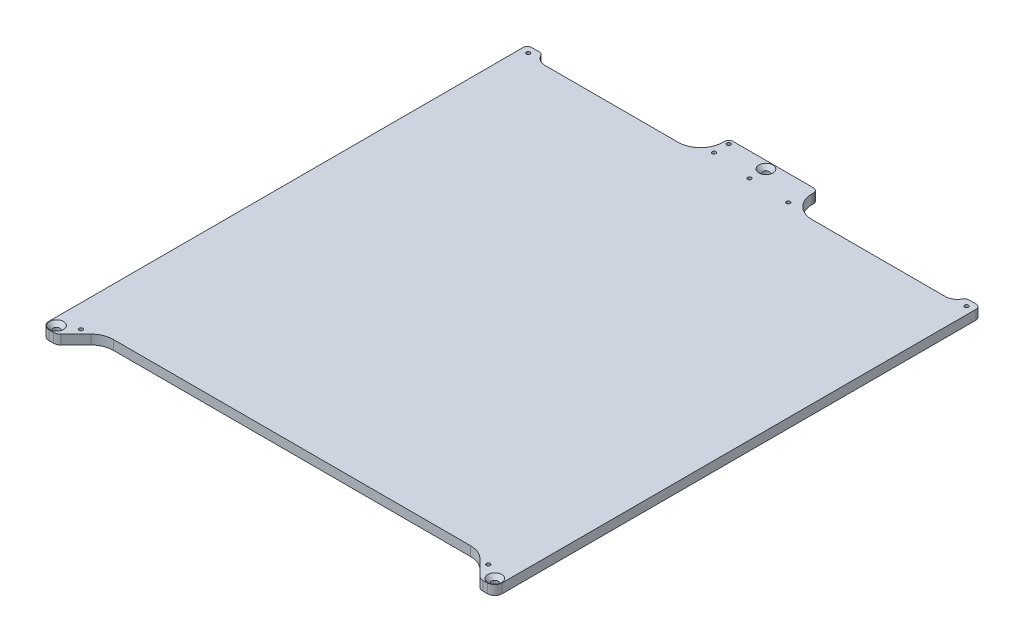
from build123d import *

# Parameters (mm, degrees)
BOSS_EXTRUDE1_DEPTH                             = 6.35
CSK_FOR_M4_FLAT_HEAD_MACHINE_SCREW1_D           = 4.3
CSK_FOR_M4_FLAT_HEAD_MACHINE_SCREW1_CSINK_D     = 9.4
CSK_FOR_M4_FLAT_HEAD_MACHINE_SCREW1_CSINK_ANGLE = 90
CHAMFER1_SIZE                                   = 16
SKETCH6_W                                       = 10
SKETCH6_H                                       = 6
BOSS_EXTRUDE2_DEPTH                             = 6.35
FILLET5_R                                       = 8
M3X0_5_TAPPED_HOLE1_D                           = 2.5
FILLET6_START                                   = -1
FILLET6_DEPTH                                   = 8
SKETCH18_W                                      = 25
SKETCH18_H                                      = 19
BOSS_EXTRUDE4_DEPTH                             = 6.35
FILLET11_R                                      = 15
FILLET12_R                                      = 3
TAP_DRILL_FOR_M3X0_5_TAP2_D                     = 2.5


with BuildPart() as part:
    # Sketch1 → Boss-Extrude1 (new body)
    with BuildSketch(Plane(origin=(0, 0, 0), x_dir=(1, 0, 0), z_dir=(0, 1, 0))):
        Polygon((-5, 171.5), (5, 171.5), (5, 152.5), (152.5, 152.5), (152.5, -168.5), (142.5, -168.5), (142.5, -152.5), (-142.5, -152.5), (-142.5, -168.5), (-152.5, -168.5), (-152.5, 152.5), (-5, 152.5), align=None)
    extrude(amount=BOSS_EXTRUDE1_DEPTH)

    # CSK for M4 Flat Head Machine Screw1 (through all)
    with Locations(Plane(origin=(0, 6.35, 0), x_dir=(1, 0, 0), z_dir=(0, 1, 0))):
        with Locations((0, 166.5), (-147.5, -163.5), (147.5, -163.5)):
            CounterSinkHole(CSK_FOR_M4_FLAT_HEAD_MACHINE_SCREW1_D / 2, CSK_FOR_M4_FLAT_HEAD_MACHINE_SCREW1_CSINK_D / 2, counter_sink_angle=CSK_FOR_M4_FLAT_HEAD_MACHINE_SCREW1_CSINK_ANGLE)

    # Chamfer1
    chamfer1_edges = [part.edges().sort_by_distance(p)[0] for p in [
        (142.5, 3.175, 152.5),
        (-142.5, 3.175, 152.5),
    ]]
    chamfer(chamfer1_edges, length=CHAMFER1_SIZE - 0.0001)  # a hair under: the kernel refuses the full size

    # Sketch6 → Boss-Extrude2 (add)
    with BuildSketch(Plane(origin=(0, 6.35, 0), x_dir=(1, 0, 0), z_dir=(0, 1, 0))):
        with Locations((-147.5, 155.5)):
            Rectangle(SKETCH6_W, SKETCH6_H)
        with Locations((147.5, 155.5)):
            Rectangle(SKETCH6_W, SKETCH6_H)
    extrude(amount=-BOSS_EXTRUDE2_DEPTH)

    # Fillet5
    # the kernel refuses this fillet: 8 mm, written as the material it adds along each edge
    with BuildSketch(Plane(origin=(142.5, 6.35, -152.5), x_dir=(0, 0, -1), z_dir=(0, -1, 0))) as fillet5_piece_1:
        with BuildLine():
            CenterArc((8, -7.745966692), FILLET5_R, 104.477512186, 75.522487814)
            Line((0, -7.745966692), (-0.16, -7.745966692))
            Line((-0.16, -7.745966692), (-0.16, 0))
            Line((-0.16, 0), (0, 0.16))
            ThreePointArc((0, 0.16), (3, 0.16), (5.96, 0.154919334))
            Line((5.96, 0.154919334), (6, 0))
        make_face()
    extrude(amount=6.35)
    with BuildSketch(Plane(origin=(-142.5, 6.35, -152.5), x_dir=(1, 0, 0), z_dir=(0, -1, 0))) as fillet5_piece_2:
        with BuildLine():
            CenterArc((7.745966692, -8), FILLET5_R, 90, 75.522487814)
            Line((0, -6), (-0.154919334, -5.96))
            ThreePointArc((-0.154919334, -5.96), (-0.16, -3), (-0.16, 0))
            Line((-0.16, 0), (0, 0.16))
            Line((0, 0.16), (7.745966692, 0.16))
            Line((7.745966692, 0.16), (7.745966692, 0))
        make_face()
    extrude(amount=6.35)

    # M3x0.5 Tapped Hole1 (through all)
    with Locations(Plane(origin=(0, 6.35, 0), x_dir=(1, 0, 0), z_dir=(0, 1, 0))):
        with Locations((-147.5, 154), (147.5, 154), (137.107695155, -157.5), (-137.107695155, -157.5), (0, 155.5)):
            Hole(M3X0_5_TAPPED_HOLE1_D / 2)

    # Fillet6: read off the stored shape, not the designer's step
    # Fillet6 outline → Fillet6 (cut)
    with BuildSketch(Plane(origin=(0, 0, 0), x_dir=(1, 0, 0), z_dir=(0, 1, 0)).offset(FILLET6_START)):
        with BuildLine():
            ThreePointArc((152.5, -163.5), (151.035533906, -167.035533906), (147.5, -168.5))
            Line((147.5, -168.5), (152.5, -168.5))
            Line((152.5, -168.5), (152.5, -163.5))
        make_face()
        with BuildLine():
            ThreePointArc((144.571067812, -168.5), (142.65765065, -168.119397663), (141.035533906, -167.035533906))
            Line((141.035533906, -167.035533906), (142.5, -168.5))
            Line((142.5, -168.5), (144.571067812, -168.5))
        make_face()
        with BuildLine():
            ThreePointArc((-141.035533906, -167.035533906), (-142.65765065, -168.119397663), (-144.571067812, -168.5))
            Line((-144.571067812, -168.5), (-142.5, -168.5))
            Line((-142.5, -168.5), (-141.035533906, -167.035533906))
        make_face()
        with BuildLine():
            Line((-152.5, -168.5), (-147.5, -168.5))
            ThreePointArc((-147.5, -168.5), (-151.035533906, -167.035533906), (-152.5, -163.5))
            Line((-152.5, -163.5), (-152.5, -168.5))
        make_face()
    extrude(amount=FILLET6_DEPTH, mode=Mode.SUBTRACT)

    # Sketch18 → Boss-Extrude4 (add)
    with BuildSketch(Plane.XZ):
        with Locations((17.5, -162)):
            Rectangle(SKETCH18_W, SKETCH18_H)
        with Locations((-17.5, -162)):
            Rectangle(SKETCH18_W, SKETCH18_H)
    extrude(amount=-BOSS_EXTRUDE4_DEPTH)

    # Fillet11
    fillet11_edges = [part.edges().sort_by_distance(p)[0] for p in [
        (30, 3.175, -152.5),
        (-30, 3.175, -152.5),
        (-126.5001, 3.175, 152.5),
        (126.5001, 3.175, 152.5),
    ]]
    fillet(fillet11_edges, radius=FILLET11_R)

    # Fillet12
    fillet12_edges = [part.edges().sort_by_distance(p)[0] for p in [
        (30, 3.175, -171.5),
        (-30, 3.175, -171.5),
        (-142.5, 3.175, -158.5),
        (-152.5, 3.175, -158.5),
        (142.5, 3.175, -158.5),
        (152.5, 3.175, -158.5),
    ]]
    fillet(fillet12_edges, radius=FILLET12_R)

    # Tap Drill for M3x0.5 Tap2 (through all)
    with Locations(Plane(origin=(0, 6.35, 0), x_dir=(1, 0, 0), z_dir=(0, 1, 0))):
        with Locations((27, 154.5), (-27, 168.5), (-27, 158.5)):
            Hole(TAP_DRILL_FOR_M3X0_5_TAP2_D / 2)


solid = part.part
